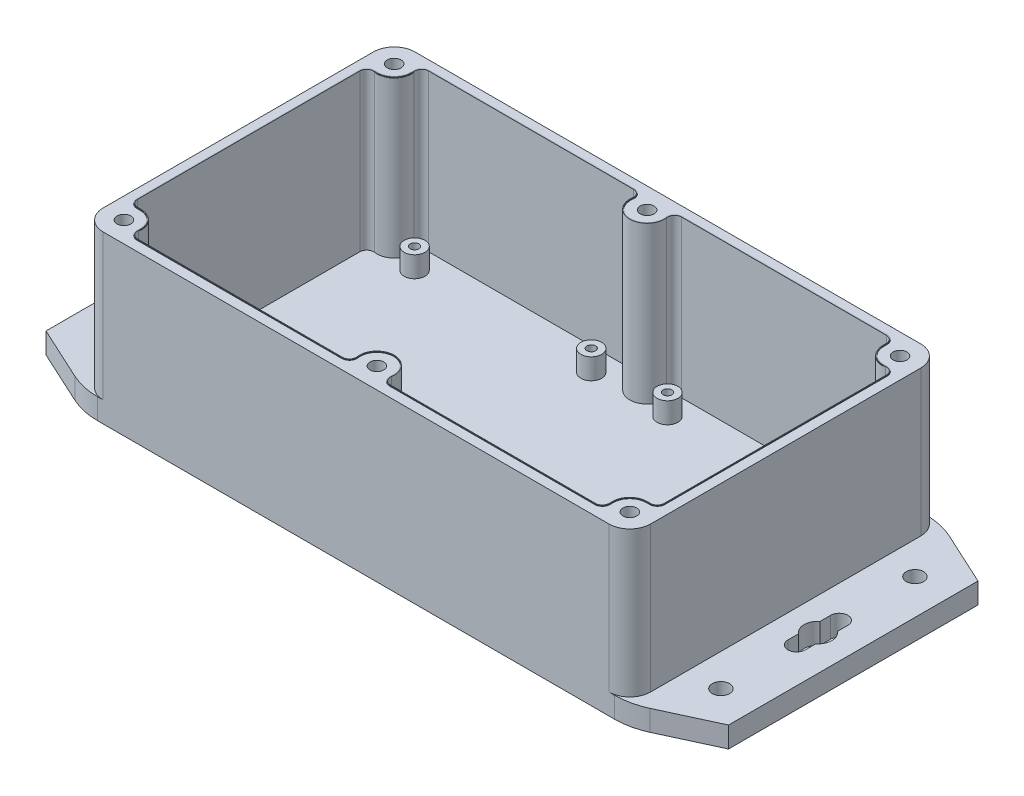
from build123d import *

# Parameters (mm, degrees)
SKETCH1_W           = 158
SKETCH1_H           = 90
BOSS_EXTRUDE1_DEPTH = 48
BOSS_EXTRUDE2_DEPTH = 6
HOLE2_D             = 5
CUT_EXTRUDE1_DEPTH  = 187.622613849
SHELL1_START        = 3
SHELL1_OUTLINE_W    = 45
SHELL1_OUTLINE_H    = 84
SHELL1_DEPTH        = 152
SKETCH7_R           = 5
BOSS_EXTRUDE3_DEPTH = 45
HOLE1_D             = 4
HOLE1_CBORE_D       = 7.5
HOLE1_CBORE_DEPTH   = 42
FILLET3_R           = 2
EXTRUDE_THIN1_DEPTH = 0.2
SKETCH12_R          = 3
BOSS_EXTRUDE4_DEPTH = 6
HOLE3_D             = 2.5
HOLE3_DEPTH         = 6
FILLET1_R           = 6
FILLET2_R           = 20


# Read off the part's stored shape, not the designer's step: Shell1
with BuildPart() as part:
    # Sketch1 → Boss-Extrude1 (new body)
    with BuildSketch(Plane(origin=(0, 0, 0), x_dir=(1, 0, 0), z_dir=(0, 1, 0))):
        with Locations((79, 45)):
            Rectangle(SKETCH1_W, SKETCH1_H)
    extrude(amount=BOSS_EXTRUDE1_DEPTH)

    # Sketch2 → Boss-Extrude2 (add)
    with BuildSketch(Plane.XZ):
        Polygon((-19.5, -9), (0, 0), (0, -90), (-19.5, -81), align=None)
    boss_extrude2 = extrude(amount=-BOSS_EXTRUDE2_DEPTH)

    # Hole2 (through all)
    with Locations(Plane(origin=(0, 6, 0), x_dir=(1, 0, 0), z_dir=(0, 1, 0))):
        with Locations((-9.3, 73), (-9.3, 17)):
            hole2 = Hole(HOLE2_D / 2)

    # Sketch10 → Cut-Extrude1 (cut, through all)
    with BuildSketch(Plane(origin=(0, 6, 0), x_dir=(1, 0, 0), z_dir=(0, 1, 0))):
        with BuildLine():
            Line((-11.8, 51.15), (-11.8, 48.122498999))
            ThreePointArc((-11.8, 48.122498999), (-13.3, 45), (-11.8, 41.877501001))
            Line((-11.8, 41.877501001), (-11.8, 38.85))
            ThreePointArc((-11.8, 38.85), (-9.3, 36.35), (-6.8, 38.85))
            Line((-6.8, 38.85), (-6.8, 41.877501001))
            ThreePointArc((-6.8, 41.877501001), (-5.3, 45), (-6.8, 48.122498999))
            Line((-6.8, 48.122498999), (-6.8, 51.15))
            ThreePointArc((-6.8, 51.15), (-9.3, 53.65), (-11.8, 51.15))
        make_face()
    cut_extrude1 = extrude(amount=-CUT_EXTRUDE1_DEPTH, mode=Mode.SUBTRACT)

    # Shell1 outline → Shell1 (cut)
    with BuildSketch(Plane.YZ.offset(SHELL1_START)):
        with Locations((25.5, -45)):
            Rectangle(SHELL1_OUTLINE_W, SHELL1_OUTLINE_H)
    extrude(amount=SHELL1_DEPTH, mode=Mode.SUBTRACT)

    # Sketch7 → Boss-Extrude3 (add)
    with BuildSketch(Plane(origin=(0, 3, 0), x_dir=(1, 0, 0), z_dir=(0, 1, 0))):
        with Locations((79, 84)):
            Circle(SKETCH7_R)
        with Locations((6, 84)):
            Circle(SKETCH7_R)
        with Locations((6, 6)):
            Circle(SKETCH7_R)
        with Locations((79, 6)):
            Circle(SKETCH7_R)
        with Locations((152, 6)):
            Circle(SKETCH7_R)
        with Locations((152, 84)):
            Circle(SKETCH7_R)
    extrude(amount=BOSS_EXTRUDE3_DEPTH)

    # Mirror1: Boss-Extrude2, Hole2, Cut-Extrude1 across plane
    add(boss_extrude2.mirror(Plane(origin=(79, 0, 0), x_dir=(0, 0, 1), z_dir=(1, 0, 0))))
    add(hole2.mirror(Plane(origin=(79, 0, 0), x_dir=(0, 0, 1), z_dir=(1, 0, 0))), mode=Mode.SUBTRACT)
    add(cut_extrude1.mirror(Plane(origin=(79, 0, 0), x_dir=(0, 0, 1), z_dir=(1, 0, 0))), mode=Mode.SUBTRACT)

    # Hole1 (through all)
    with Locations(Plane(origin=(0, 0, 0), x_dir=(-1, 0, 0), z_dir=(0, -1, 0))):
        with Locations((-152, 84), (-152, 6), (-79, 84), (-79, 6), (-6, 84), (-6, 6)):
            CounterBoreHole(HOLE1_D / 2, HOLE1_CBORE_D / 2, HOLE1_CBORE_DEPTH)

    # Fillet3
    fillet3_edges = [part.edges().sort_by_distance(p)[0] for p in [
        (3, 25.5, -80),
        (10, 25.5, -87),
        (10, 25.5, -3),
        (3, 25.5, -10),
        (83, 25.5, -3),
        (75, 25.5, -3),
        (155, 25.5, -10),
        (148, 25.5, -3),
        (155, 25.5, -80),
        (148, 25.5, -87),
        (75, 25.5, -87),
        (83, 25.5, -87),
    ]]
    fillet(fillet3_edges, radius=FILLET3_R)

    # Sketch11 → Extrude-Thin1 (add)
    with BuildSketch(Plane(origin=(0, 48, 0), x_dir=(1, 0, 0), z_dir=(0, 1, 0))):
        with BuildLine():
            ThreePointArc((83.750767929, 5.314285714), (79, 10.8), (74.249232071, 5.314285714))
            ThreePointArc((74.249232071, 5.314285714), (73.734840451, 3.559761924), (72.07179677, 2.8))
            Line((72.07179677, 2.8), (12.92820323, 2.8))
            ThreePointArc((12.92820323, 2.8), (11.372568312, 3.444365081), (10.72820323, 5))
            Line((10.72820323, 5), (10.72820323, 5.92820323))
            ThreePointArc((10.72820323, 5.92820323), (9.32231578, 9.32231578), (5.92820323, 10.72820323))
            Line((5.92820323, 10.72820323), (5, 10.72820323))
            ThreePointArc((5, 10.72820323), (3.444365081, 11.372568312), (2.8, 12.92820323))
            Line((2.8, 12.92820323), (2.8, 77.07179677))
            ThreePointArc((2.8, 77.07179677), (3.444365081, 78.627431688), (5, 79.27179677))
            Line((5, 79.27179677), (5.92820323, 79.27179677))
            ThreePointArc((5.92820323, 79.27179677), (9.32231578, 80.67768422), (10.72820323, 84.07179677))
            Line((10.72820323, 84.07179677), (10.72820323, 85))
            ThreePointArc((10.72820323, 85), (11.372568312, 86.555634919), (12.92820323, 87.2))
            Line((12.92820323, 87.2), (72.07179677, 87.2))
            ThreePointArc((72.07179677, 87.2), (73.734840451, 86.440238076), (74.249232071, 84.685714286))
            ThreePointArc((74.249232071, 84.685714286), (79, 79.2), (83.750767929, 84.685714286))
            ThreePointArc((83.750767929, 84.685714286), (84.265159549, 86.440238076), (85.92820323, 87.2))
            Line((85.92820323, 87.2), (145.07179677, 87.2))
            ThreePointArc((145.07179677, 87.2), (146.627431688, 86.555634919), (147.27179677, 85))
            Line((147.27179677, 85), (147.27179677, 84.07179677))
            ThreePointArc((147.27179677, 84.07179677), (148.67768422, 80.67768422), (152.07179677, 79.27179677))
            Line((152.07179677, 79.27179677), (153, 79.27179677))
            ThreePointArc((153, 79.27179677), (154.555634919, 78.627431688), (155.2, 77.07179677))
            Line((155.2, 77.07179677), (155.2, 12.92820323))
            ThreePointArc((155.2, 12.92820323), (154.555634919, 11.372568312), (153, 10.72820323))
            Line((153, 10.72820323), (152.07179677, 10.72820323))
            ThreePointArc((152.07179677, 10.72820323), (148.67768422, 9.32231578), (147.27179677, 5.92820323))
            Line((147.27179677, 5.92820323), (147.27179677, 5))
            ThreePointArc((147.27179677, 5), (146.627431688, 3.444365081), (145.07179677, 2.8))
            Line((145.07179677, 2.8), (85.92820323, 2.8))
            ThreePointArc((85.92820323, 2.8), (84.265159549, 3.559761924), (83.750767929, 5.314285714))
        make_face()
        with BuildLine():
            ThreePointArc((83.948716593, 5.285714286), (79, 11), (74.051283407, 5.285714286))
            ThreePointArc((74.051283407, 5.285714286), (73.583654662, 3.690692659), (72.07179677, 3))
            Line((72.07179677, 3), (12.92820323, 3))
            ThreePointArc((12.92820323, 3), (11.513989668, 3.585786438), (10.92820323, 5))
            Line((10.92820323, 5), (10.92820323, 5.92820323))
            ThreePointArc((10.92820323, 5.92820323), (9.463737136, 9.463737136), (5.92820323, 10.92820323))
            Line((5.92820323, 10.92820323), (5, 10.92820323))
            ThreePointArc((5, 10.92820323), (3.585786438, 11.513989668), (3, 12.92820323))
            Line((3, 12.92820323), (3, 77.07179677))
            ThreePointArc((3, 77.07179677), (3.585786438, 78.486010332), (5, 79.07179677))
            Line((5, 79.07179677), (5.92820323, 79.07179677))
            ThreePointArc((5.92820323, 79.07179677), (9.463737136, 80.536262864), (10.92820323, 84.07179677))
            Line((10.92820323, 84.07179677), (10.92820323, 85))
            ThreePointArc((10.92820323, 85), (11.513989668, 86.414213562), (12.92820323, 87))
            Line((12.92820323, 87), (72.07179677, 87))
            ThreePointArc((72.07179677, 87), (73.583654662, 86.309307341), (74.051283407, 84.714285714))
            ThreePointArc((74.051283407, 84.714285714), (79, 79), (83.948716593, 84.714285714))
            ThreePointArc((83.948716593, 84.714285714), (84.416345338, 86.309307341), (85.92820323, 87))
            Line((85.92820323, 87), (145.07179677, 87))
            ThreePointArc((145.07179677, 87), (146.486010332, 86.414213562), (147.07179677, 85))
            Line((147.07179677, 85), (147.07179677, 84.07179677))
            ThreePointArc((147.07179677, 84.07179677), (148.536262864, 80.536262864), (152.07179677, 79.07179677))
            Line((152.07179677, 79.07179677), (153, 79.07179677))
            ThreePointArc((153, 79.07179677), (154.414213562, 78.486010332), (155, 77.07179677))
            Line((155, 77.07179677), (155, 12.92820323))
            ThreePointArc((155, 12.92820323), (154.414213562, 11.513989668), (153, 10.92820323))
            Line((153, 10.92820323), (152.07179677, 10.92820323))
            ThreePointArc((152.07179677, 10.92820323), (148.536262864, 9.463737136), (147.07179677, 5.92820323))
            Line((147.07179677, 5.92820323), (147.07179677, 5))
            ThreePointArc((147.07179677, 5), (146.486010332, 3.585786438), (145.07179677, 3))
            Line((145.07179677, 3), (85.92820323, 3))
            ThreePointArc((85.92820323, 3), (84.416345338, 3.690692659), (83.948716593, 5.285714286))
        make_face(mode=Mode.SUBTRACT)
    extrude(amount=EXTRUDE_THIN1_DEPTH)

    # Sketch12 → Boss-Extrude4 (add)
    with BuildSketch(Plane(origin=(0, 3, 0), x_dir=(1, 0, 0), z_dir=(0, 1, 0))):
        with Locations(Location((15.531904212, 80.35, 0), (0, 0, 90))):
            Circle(SKETCH12_R)
        with Locations(Location((66.531904212, 80.35, 0), (0, 0, 90))):
            Circle(SKETCH12_R)
        with Locations(Location((140.281904212, 80.35, 0), (0, 0, 90))):
            Circle(SKETCH12_R)
        with Locations(Location((88.531904212, 80.35, 0), (0, 0, 90))):
            Circle(SKETCH12_R)
        with Locations(Location((66.531904212, 9.65, 0), (0, 0, 90))):
            Circle(SKETCH12_R)
        with Locations(Location((15.531904212, 9.65, 0), (0, 0, 90))):
            Circle(SKETCH12_R)
        with Locations(Location((88.531904212, 9.65, 0), (0, 0, 90))):
            Circle(SKETCH12_R)
        with Locations(Location((140.281904212, 9.65, 0), (0, 0, 90))):
            Circle(SKETCH12_R)
        with Locations(Location((92.7201782, 19.233989691, 0), (0, 0, 90))):
            Circle(SKETCH12_R)
        with Locations(Location((133.4201782, 19.233989691, 0), (0, 0, 90))):
            Circle(SKETCH12_R)
    extrude(amount=BOSS_EXTRUDE4_DEPTH)

    # Hole3
    with Locations(Plane(origin=(0, 9, 0), x_dir=(1, 0, 0), z_dir=(0, 1, 0))):
        with Locations((15.531904212, 80.35), (66.531904212, 80.35), (88.531904212, 80.35), (140.281904212, 80.35), (133.4201782, 19.233989691), (92.7201782, 19.233989691), (140.281904212, 9.65), (88.531904212, 9.65), (66.531904212, 9.65), (15.531904212, 9.65)):
            Hole(HOLE3_D / 2, depth=HOLE3_DEPTH)

    # Fillet1
    fillet1_edges = [part.edges().sort_by_distance(p)[0] for p in [
        (0, 27, 0),
        (0, 27, -90),
        (158, 27, 0),
        (158, 27, -90),
    ]]
    fillet(fillet1_edges, radius=FILLET1_R)

    # Fillet2
    fillet2_edges = [part.edges().sort_by_distance(p)[0] for p in [
        (158, 3, -90),
        (158, 3, 0),
        (0, 3, -90),
        (0, 3, 0),
    ]]
    fillet(fillet2_edges, radius=FILLET2_R)


solid = part.part
